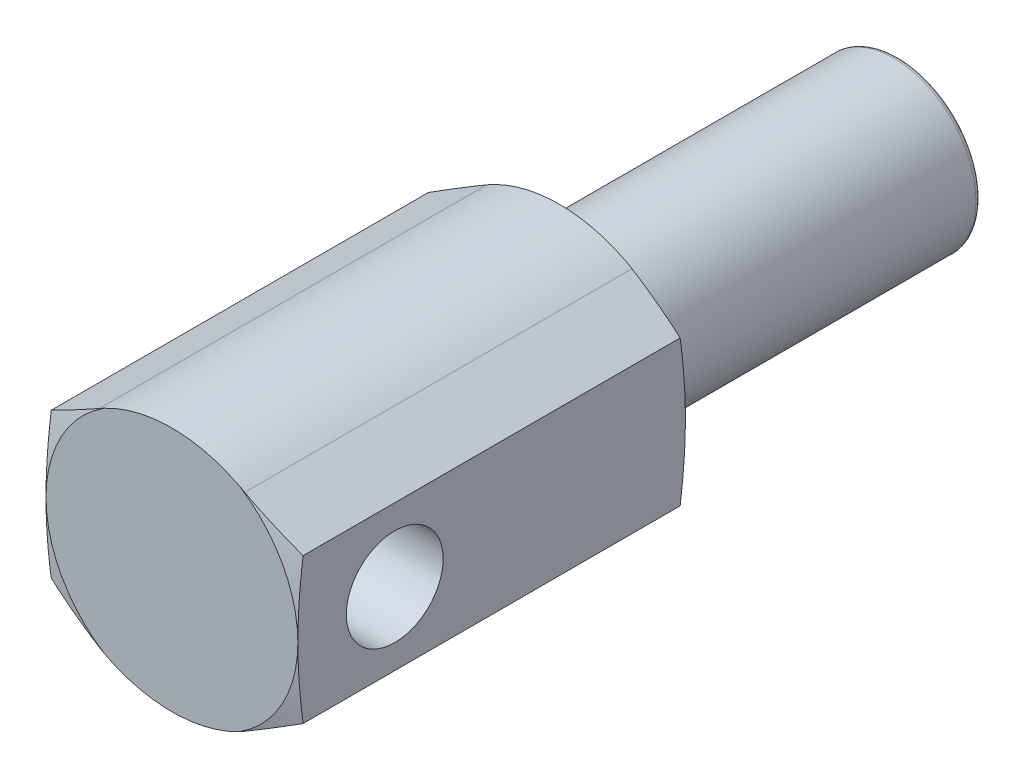
from build123d import *

# Parameters (mm, degrees)
RESSALTO_EXTRUS_O1_DEPTH  = 40
ESBO_O2_OUTSIDE_W         = 151.236
ESBO_O2_OUTSIDE_H         = 155.258
ESBO_O2_OUTSIDE_R         = 13
CORTE_EXTRUS_O1_DEPTH     = 15
CORTE_EXTRUS_O1_DRAFT     = -75
ESBO_O3_OUTSIDE_W         = 151.236
ESBO_O3_OUTSIDE_H         = 155.258
ESBO_O3_OUTSIDE_R         = 13
CORTE_EXTRUS_O2_DEPTH     = 15
CORTE_EXTRUS_O2_DRAFT     = -75
ESBO_O4_R                 = 8.5
RESSALTO_EXTRUS_O2_DEPTH  = 35
FILETE1_R                 = 0.5
FURO_ROSCADO_DE_M61_D     = 5
FURO_ROSCADO_DE_M61_DEPTH = 17
FURO_ROSCADO_DE_M61_TIP   = 1.502151548
ESBO_O7_R                 = 5
CORTE_EXTRUS_O3_DEPTH     = 51.013331556
FILETE2_R                 = 15
FILETE3_R                 = 15


with BuildPart() as part:
    # Esboço1 → Ressalto-extrusão1 (new body)
    with BuildSketch(Plane.XY):
        Polygon((0, 15.011106999), (-13, 7.505553499), (-13, -7.505553499), (0, -15.011106999), (13, -7.505553499), (13, 7.505553499), align=None)
    extrude(amount=RESSALTO_EXTRUS_O1_DEPTH)


with BuildPart() as corte_extrus_o1_tool:
    # Esboço2 outside → Corte-extrusão1 (with draft: the straight prism first)
    with BuildSketch(Plane.XY.offset(40)):
        Rectangle(ESBO_O2_OUTSIDE_W, ESBO_O2_OUTSIDE_H)
        Circle(ESBO_O2_OUTSIDE_R, mode=Mode.SUBTRACT)
    extrude(amount=-CORTE_EXTRUS_O1_DEPTH)
    # Corte-extrusão1: the draft: its side faces are tilted about the plane it starts from
    corte_extrus_o1_sides = [corte_extrus_o1_tool.faces().sort_by_distance(p)[0] for p in [
        (0, -77.629, 32.5),
        (75.618, 0, 32.5),
        (0, 77.629, 32.5),
        (-75.618, 0, 32.5),
        (-13, 0, 32.5),
    ]]
    draft(corte_extrus_o1_sides, Plane.XY.offset(40), CORTE_EXTRUS_O1_DRAFT)


with BuildPart() as part_1:
    add(part.part)

    # Corte-extrusão1: cut by corte_extrus_o1_tool
    add(corte_extrus_o1_tool.part, mode=Mode.SUBTRACT)


with BuildPart() as corte_extrus_o2_tool:
    # Esboço3 outside → Corte-extrusão2 (with draft: the straight prism first)
    with BuildSketch(Plane(origin=(0, 0, 0), x_dir=(-1, 0, 0), z_dir=(0, 0, -1))):
        Rectangle(ESBO_O3_OUTSIDE_W, ESBO_O3_OUTSIDE_H)
        Circle(ESBO_O3_OUTSIDE_R, mode=Mode.SUBTRACT)
    extrude(amount=-CORTE_EXTRUS_O2_DEPTH)
    # Corte-extrusão2: the draft: its side faces are tilted about the plane it starts from
    corte_extrus_o2_sides = [corte_extrus_o2_tool.faces().sort_by_distance(p)[0] for p in [
        (0, -77.629, 7.5),
        (-75.618, 0, 7.5),
        (0, 77.629, 7.5),
        (75.618, 0, 7.5),
        (13, 0, 7.5),
    ]]
    draft(corte_extrus_o2_sides, Plane(origin=(0, 0, 0), x_dir=(-1, 0, 0), z_dir=(0, 0, -1)), CORTE_EXTRUS_O2_DRAFT)


with BuildPart() as part_2:
    add(part_1.part)

    # Corte-extrusão2: cut by corte_extrus_o2_tool
    add(corte_extrus_o2_tool.part, mode=Mode.SUBTRACT)

    # Esboço4 → Ressalto-extrusão2 (add)
    with BuildSketch(Plane(origin=(0, 0, 0), x_dir=(-1, 0, 0), z_dir=(0, 0, -1))):
        with Locations(Location((0, 0, 0), (0, 0, 180))):
            Circle(ESBO_O4_R)
    extrude(amount=RESSALTO_EXTRUS_O2_DEPTH)

    # Filete1
    filete1_edges = [part_2.edges().sort_by_distance(p)[0] for p in [
        (-8.5, 0, -35),
    ]]
    fillet(filete1_edges, radius=FILETE1_R)

    # Furo roscado de M61
    with Locations(Plane(origin=(0, 0, -35), x_dir=(-1, 0, 0), z_dir=(0, 0, -1))):
        with Locations((0, 0)):
            Hole(FURO_ROSCADO_DE_M61_D / 2, depth=FURO_ROSCADO_DE_M61_DEPTH)
            with Locations((0, 0, -(FURO_ROSCADO_DE_M61_DEPTH + FURO_ROSCADO_DE_M61_TIP / 2))):  # 118° drill point
                Cone(0, FURO_ROSCADO_DE_M61_D / 2, FURO_ROSCADO_DE_M61_TIP, mode=Mode.SUBTRACT)

    # Esboço7 → Corte-extrusão3 (cut, through all)
    with BuildSketch(Plane.ZY.offset(13)):
        with Locations(Location((30, 0, 0), (0, 0, 270))):
            Circle(ESBO_O7_R)
    extrude(amount=-CORTE_EXTRUS_O3_DEPTH, mode=Mode.SUBTRACT)

    # Filete2
    # the kernel refuses this fillet: 15 mm, written as the material it takes off along each edge
    with BuildSketch(Plane(origin=(0, 15.011106999, -21.111760598), x_dir=(0.8660254037844415, -0.49999999999999506, 0), z_dir=(0, 0, 1))) as filete2_piece_1:
        with BuildLine():
            CenterArc((FILETE2_R * 0.57735026919, -FILETE2_R), FILETE2_R, 90, 60)
            Line((-FILETE2_R * 0.288675134595, -FILETE2_R * 0.5), (0, 0))
            Line((0, 0), (FILETE2_R * 0.57735026919, 0))
        make_face()
    extrude(amount=82.223521197, mode=Mode.SUBTRACT)

    # Filete3
    # the kernel refuses this fillet: 15 mm, written as the material it takes off along each edge
    with BuildSketch(Plane(origin=(0, -15.011106999, -21.111760598), x_dir=(0.8660254037844344, 0.5000000000000074, 0), z_dir=(0, 0, 1))) as filete3_piece_1:
        with BuildLine():
            CenterArc((FILETE3_R * 0.57735026919, FILETE3_R), FILETE3_R, 210, 60)
            Line((-FILETE3_R * 0.288675134595, FILETE3_R * 0.5), (0, 0))
            Line((0, 0), (FILETE3_R * 0.57735026919, 0))
        make_face()
    extrude(amount=82.223521197, mode=Mode.SUBTRACT)


solid = part_2.part
